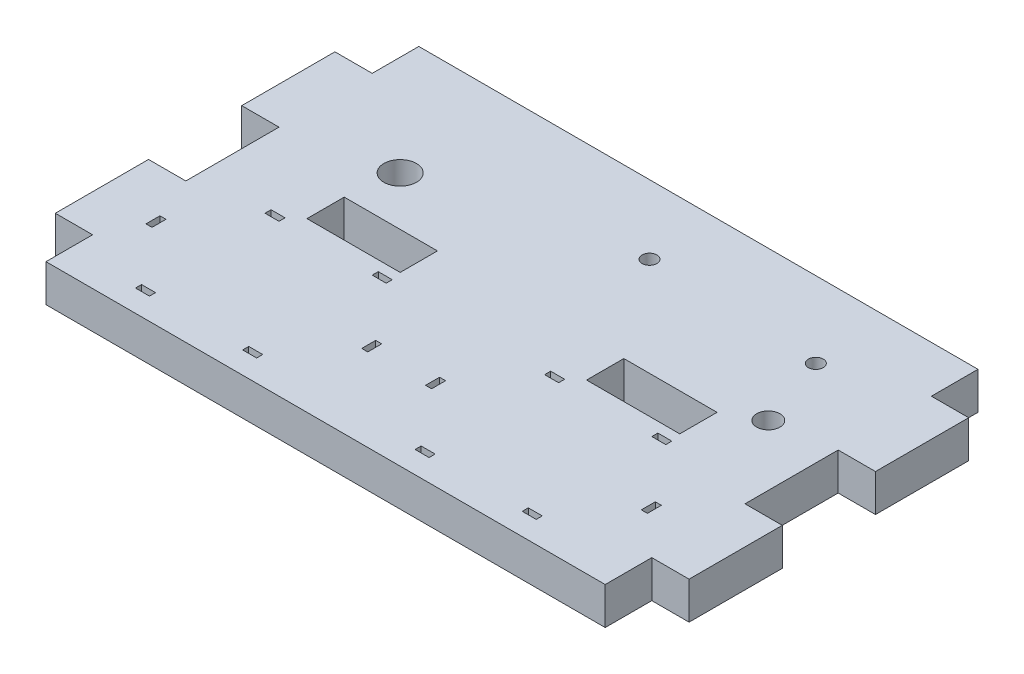
from build123d import *

# Parameters (mm, degrees)
SKETCH1_W           = 120
SKETCH1_H           = 80
SKETCH1_R           = 1.6
SKETCH1_R_2         = 3.5
SKETCH1_R_3         = 2.5
SKETCH1_W_2         = 3
SKETCH1_H_2         = 1.3
SKETCH1_W_3         = 1.3
SKETCH1_H_3         = 3
BOSS_EXTRUDE1_DEPTH = 8
CUT_EXTRUDE1_DEPTH  = 4
SKETCH3_W           = 20
SKETCH3_H           = 8
BOSS_EXTRUDE2_DEPTH = 8
CUT_EXTRUDE3_REACH  = 81.297
SKETCH5_W           = 20
SKETCH5_H           = 8


with BuildPart() as part:
    # Sketch1 → Boss-Extrude1 (new body)
    with BuildSketch(Plane(origin=(0, 0, 0), x_dir=(1, 0, 0), z_dir=(0, 1, 0))):
        Rectangle(SKETCH1_W, SKETCH1_H)
        with Locations((41.5, 23.7)):
            Circle(SKETCH1_R, mode=Mode.SUBTRACT)
        with Locations((4.3, 25.2)):
            Circle(SKETCH1_R, mode=Mode.SUBTRACT)
        with Locations((-38.5, 14.5)):
            Circle(SKETCH1_R_2, mode=Mode.SUBTRACT)
        with Locations((47, 8)):
            Circle(SKETCH1_R_3, mode=Mode.SUBTRACT)
        with Locations((39, -6.85)):
            Rectangle(SKETCH1_W_2, SKETCH1_H_2, mode=Mode.SUBTRACT)
        with Locations((16, -6.85)):
            Rectangle(SKETCH1_W_2, SKETCH1_H_2, mode=Mode.SUBTRACT)
        with Locations((4.35, -20.75)):
            Rectangle(SKETCH1_W_3, SKETCH1_H_3, mode=Mode.SUBTRACT)
        with Locations((50.65, -20.75)):
            Rectangle(SKETCH1_W_3, SKETCH1_H_3, mode=Mode.SUBTRACT)
        with Locations((39, -34.65)):
            Rectangle(SKETCH1_W_2, SKETCH1_H_2, mode=Mode.SUBTRACT)
        with Locations((16, -34.65)):
            Rectangle(SKETCH1_W_2, SKETCH1_H_2, mode=Mode.SUBTRACT)
        with Locations((-21, -34.65)):
            Rectangle(SKETCH1_W_2, SKETCH1_H_2, mode=Mode.SUBTRACT)
        with Locations((-44, -34.65)):
            Rectangle(SKETCH1_W_2, SKETCH1_H_2, mode=Mode.SUBTRACT)
        with Locations((-55.65, -20.75)):
            Rectangle(SKETCH1_W_3, SKETCH1_H_3, mode=Mode.SUBTRACT)
        with Locations((-44, -6.85)):
            Rectangle(SKETCH1_W_2, SKETCH1_H_2, mode=Mode.SUBTRACT)
        with Locations((-9.35, -20.75)):
            Rectangle(SKETCH1_W_3, SKETCH1_H_3, mode=Mode.SUBTRACT)
        with Locations((-21, -6.85)):
            Rectangle(SKETCH1_W_2, SKETCH1_H_2, mode=Mode.SUBTRACT)
    extrude(amount=BOSS_EXTRUDE1_DEPTH)

    # Sketch2 → Cut-Extrude1 (cut)
    with BuildSketch(Plane(origin=(0, 0, 0), x_dir=(-1, 0, 0), z_dir=(0, -1, 0))):
        Polygon((-7.475426481, 25.2), (-5.88771324, 22.45), (-2.71228676, 22.45), (-1.124573519, 25.2), (-2.71228676, 27.95), (-5.88771324, 27.95), align=None)
        Polygon((-44.675426481, 23.7), (-43.08771324, 20.95), (-39.91228676, 20.95), (-38.324573519, 23.7), (-39.91228676, 26.45), (-43.08771324, 26.45), align=None)
    extrude(amount=-CUT_EXTRUDE1_DEPTH, mode=Mode.SUBTRACT)

    # Sketch3 → Boss-Extrude2 (add)
    with BuildSketch(Plane.ZY.offset(60)):
        with Locations((-20, 4)):
            Rectangle(SKETCH3_W, SKETCH3_H)
        with Locations((20, 4)):
            Rectangle(SKETCH3_W, SKETCH3_H)
    boss_extrude2 = extrude(amount=BOSS_EXTRUDE2_DEPTH)

    # Mirror1: Boss-Extrude2 across plane
    add(boss_extrude2.mirror(Plane.ZY))

    # Sketch5 → Cut-Extrude3 (cut, up to next)
    with BuildSketch(Plane(origin=(0, 0, 0), x_dir=(-1, 0, 0), z_dir=(0, -1, 0)), mode=Mode.PRIVATE) as cut_extrude3_sk1:
        with Locations((30, 0)):
            Rectangle(SKETCH5_W, SKETCH5_H)
    cut_extrude3_tool1 = extrude(cut_extrude3_sk1.sketch, amount=-CUT_EXTRUDE3_REACH, mode=Mode.PRIVATE) & part.part
    cut_extrude3 = cut_extrude3_tool1.solids().sort_by_distance((-30, 0, 0))[0]
    add(cut_extrude3, mode=Mode.SUBTRACT)

    # Mirror2: Cut-Extrude3 across plane
    add(cut_extrude3.mirror(Plane.ZY), mode=Mode.SUBTRACT)


solid = part.part
